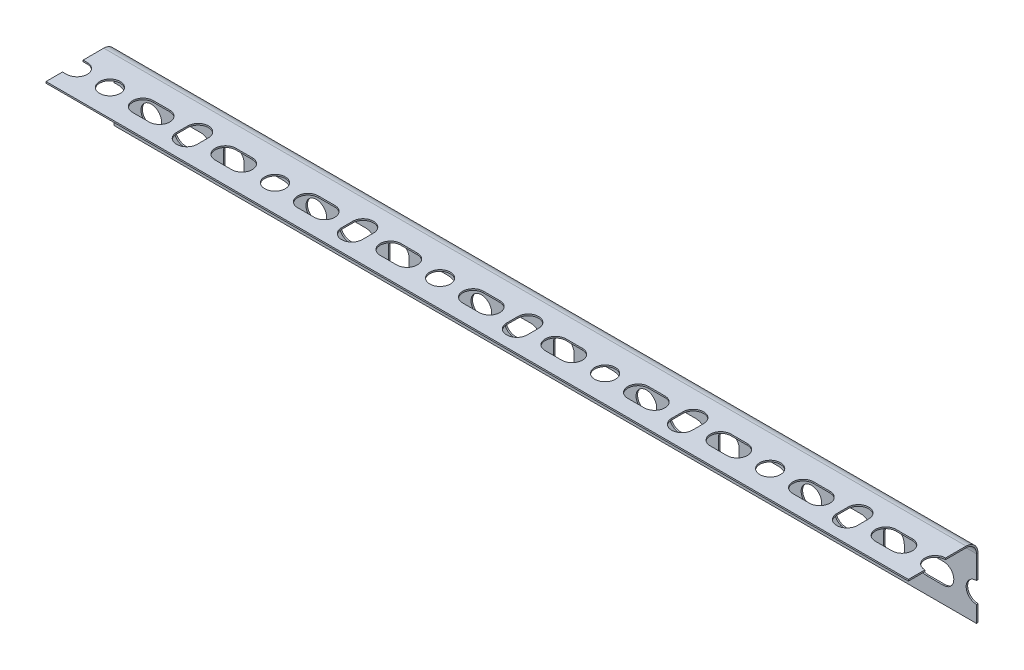
from build123d import *

# Parameters (mm, degrees)
SKETCH1_W                    = 418
SKETCH1_H                    = 0.7366
BASE_FLANGE1_DEPTH           = 35
EDGE_FLANGE1_STRIP_W         = 12.9464
EDGE_FLANGE1_STRIP_H         = 0.7366
EDGE_FLANGE1_STRIP_CUT_DEPTH = 418
EDGE_FLANGE1_DEPTH           = 418
SKETCH11_R                   = 5
CUT_EXTRUDE1_DEPTH           = 215.579025488
LPATTERN1_COUNT              = 14
LPATTERN1_PITCH              = 80
SKETCH12_R                   = 5
CUT_EXTRUDE2_DEPTH           = 35
LPATTERN2_COUNT              = 15
LPATTERN2_PITCH              = 80


# Sheet-metal steps are written as plain solids
with BuildPart() as part:
    # Sketch1 → Base-Flange1 (new body)
    with BuildSketch(Plane(origin=(0, 0, 0), x_dir=(1, 0, 0), z_dir=(0, 1, 0))):
        with Locations((0, -0.3683)):
            Rectangle(SKETCH1_W, SKETCH1_H)
    extrude(amount=BASE_FLANGE1_DEPTH)

    # Edge-Flange1 strip (across the edge) → Edge-Flange1 strip cut (cut)
    with BuildSketch(Plane(origin=(209, 35, 0.7366), x_dir=(0, -1, 0), z_dir=(-1, 0, 0))):
        with Locations((-0.7366, -0.3683)):
            Rectangle(EDGE_FLANGE1_STRIP_W, EDGE_FLANGE1_STRIP_H)
    extrude(amount=EDGE_FLANGE1_STRIP_CUT_DEPTH, mode=Mode.SUBTRACT)

    # Edge-Flange1 section (across the edge) → Edge-Flange1 (add)
    with BuildSketch(Plane(origin=(209, 35, 0.7366), x_dir=(0, -1, 0), z_dir=(-1, 0, 0))):
        with BuildLine():
            Line((0, 5), (0, 33))
            Line((0, 33), (0.7366, 33))
            Line((0.7366, 33), (0.7366, 5))
            ThreePointArc((0.7366, 5), (2.201066094, 1.464466094), (5.7366, 0))
            Line((5.7366, 0), (5.7366, -0.7366))
            ThreePointArc((5.7366, -0.7366), (1.680211239, 0.943611239), (0, 5))
        make_face()
    extrude(amount=EDGE_FLANGE1_DEPTH)

    # Sketch11 → Cut-Extrude1 (cut, through all)
    with BuildSketch(Plane(origin=(0, 35, 0), x_dir=(1, 0, 0), z_dir=(0, 1, 0))):
        with Locations((209, -20.7366)):
            Circle(SKETCH11_R)
        with BuildLine():
            Line((193, -25.7366), (185, -25.7366))
            ThreePointArc((185, -25.7366), (180, -20.7366), (185, -15.7366))
            Line((185, -15.7366), (193, -15.7366))
            ThreePointArc((193, -15.7366), (198, -20.7366), (193, -25.7366))
        make_face()
        with BuildLine():
            Line((153, -25.7366), (145, -25.7366))
            ThreePointArc((145, -25.7366), (140, -20.7366), (145, -15.7366))
            Line((145, -15.7366), (153, -15.7366))
            ThreePointArc((153, -15.7366), (158, -20.7366), (153, -25.7366))
        make_face()
        with BuildLine():
            Line((164, -23.4866), (164, -17.9866))
            ThreePointArc((164, -17.9866), (169, -12.9866), (174, -17.9866))
            Line((174, -17.9866), (174, -23.4866))
            ThreePointArc((174, -23.4866), (169, -28.4866), (164, -23.4866))
        make_face()
    cut_extrude1 = extrude(amount=-CUT_EXTRUDE1_DEPTH, mode=Mode.SUBTRACT)

    # LPattern1: Cut-Extrude1 ×14
    with Locations(*[(-i * LPATTERN1_PITCH, 0, 0) for i in range(1, LPATTERN1_COUNT)]):
        add(cut_extrude1, mode=Mode.SUBTRACT)

    # Sketch12 → Cut-Extrude2 (cut)
    with BuildSketch(Plane.XY.offset(0.7366)):
        with Locations((209, 13)):
            Circle(SKETCH12_R)
        with BuildLine():
            Line((193, 8), (185, 8))
            ThreePointArc((185, 8), (180, 13), (185, 18))
            Line((185, 18), (193, 18))
            ThreePointArc((193, 18), (198, 13), (193, 8))
        make_face()
        with BuildLine():
            Line((164, 10.25), (164, 15.75))
            ThreePointArc((164, 15.75), (169, 20.75), (174, 15.75))
            Line((174, 15.75), (174, 10.25))
            ThreePointArc((174, 10.25), (169, 5.25), (164, 10.25))
        make_face()
        with BuildLine():
            Line((153, 8), (145, 8))
            ThreePointArc((145, 8), (140, 13), (145, 18))
            Line((145, 18), (153, 18))
            ThreePointArc((153, 18), (158, 13), (153, 8))
        make_face()
    cut_extrude2 = extrude(amount=-CUT_EXTRUDE2_DEPTH, mode=Mode.SUBTRACT)

    # LPattern2: Cut-Extrude2 ×15
    with Locations(*[(-i * LPATTERN2_PITCH, 0, 0) for i in range(1, LPATTERN2_COUNT)]):
        add(cut_extrude2, mode=Mode.SUBTRACT)


solid = part.part
